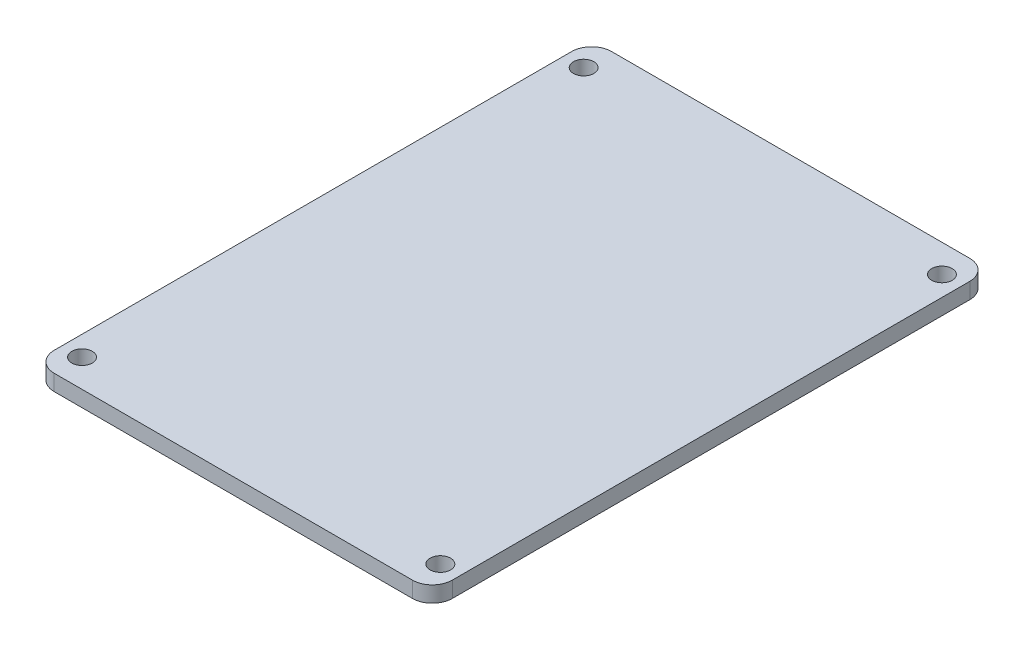
from build123d import *

# Parameters (mm, degrees)
SKETCH1_R           = 1.63195
BOSS_EXTRUDE1_DEPTH = 2.54


with BuildPart() as part:
    # Sketch1 → Boss-Extrude1 (new body)
    with BuildSketch(Plane(origin=(0, 0, 0), x_dir=(1, 0, 0), z_dir=(0, 1, 0))):
        with BuildLine():
            Line((-28.575, 44.45), (28.575, 44.45))
            ThreePointArc((28.575, 44.45), (30.82006403, 43.52006403), (31.75, 41.275))
            Line((31.75, 41.275), (31.75, -41.275))
            ThreePointArc((31.75, -41.275), (30.82006403, -43.52006403), (28.575, -44.45))
            Line((28.575, -44.45), (-28.575, -44.45))
            ThreePointArc((-28.575, -44.45), (-30.82006403, -43.52006403), (-31.75, -41.275))
            Line((-31.75, -41.275), (-31.75, 41.275))
            ThreePointArc((-31.75, 41.275), (-30.82006403, 43.52006403), (-28.575, 44.45))
        make_face()
        with Locations((28.575, 40.005)):
            Circle(SKETCH1_R, mode=Mode.SUBTRACT)
        with Locations((28.575, -40.005)):
            Circle(SKETCH1_R, mode=Mode.SUBTRACT)
        with Locations((-28.575, -40.005)):
            Circle(SKETCH1_R, mode=Mode.SUBTRACT)
        with Locations((-28.575, 40.005)):
            Circle(SKETCH1_R, mode=Mode.SUBTRACT)
    extrude(amount=BOSS_EXTRUDE1_DEPTH)


solid = part.part
